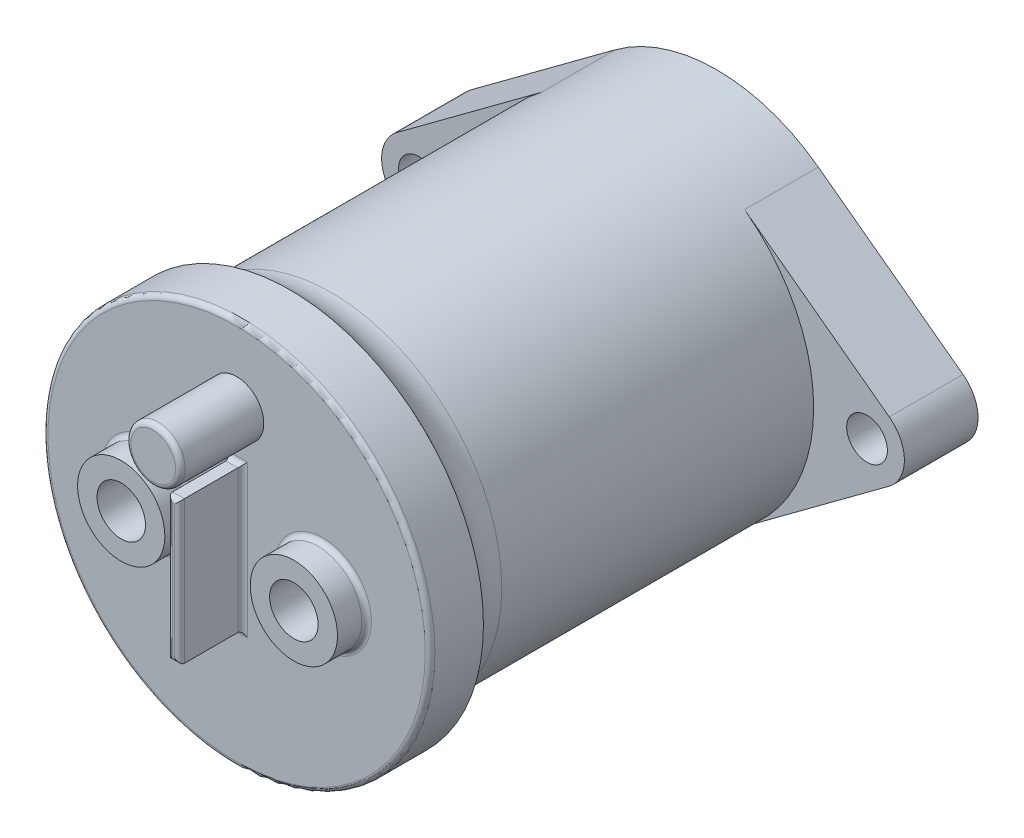
from build123d import *

# Parameters (mm, degrees)
SKETCH2_R           = 17.6
BOSS_EXTRUDE1_DEPTH = 52.5
SKETCH3_R           = 2.1
BOSS_EXTRUDE2_DEPTH = 7.6
SKETCH4_W           = 1.23
SKETCH4_H           = 14.7
BOSS_EXTRUDE3_DEPTH = 3.5
CUT_EXTRUDE1_START  = -3
SKETCH5_R           = 17.6
SKETCH5_R_2         = 4.5
SKETCH5_W           = 1.23
SKETCH5_H           = 14.7
SKETCH5_R_3         = 2.5
CUT_EXTRUDE1_DEPTH  = 3
SKETCH7_R           = 19.95
BOSS_EXTRUDE5_DEPTH = 5.5
FILLET3_R           = 5
FILLET4_R           = 0.5
CUT_EXTRUDE2_START  = -7
SKETCH8_R           = 2.5
CUT_EXTRUDE2_DEPTH  = 7
SKETCH10_R          = 2.8
BOSS_EXTRUDE6_DEPTH = 8.6
FILLET5_R           = 0.5


with BuildPart() as part:
    # Sketch2 → Boss-Extrude1 (new body)
    with BuildSketch(Plane.XY):
        Circle(SKETCH2_R)
    extrude(amount=BOSS_EXTRUDE1_DEPTH)

    # Sketch3 → Boss-Extrude2 (add)
    # profile 1 of 2: a face of its own
    with BuildSketch(Plane.XY):
        with BuildLine():
            Line((-10.476190476, 14.14246913), (-25.391666667, 3.093665122))
            ThreePointArc((-25.391666667, 3.093665122), (-26.95, 0), (-25.391666667, -3.093665122))
            Line((-25.391666667, -3.093665122), (-10.476190476, -14.14246913))
            ThreePointArc((-10.476190476, -14.14246913), (-17.6, 0), (-10.476190476, 14.14246913))
        make_face()
        with Locations(Location((-23.1, 0, 0), (0, 0, 180))):
            Circle(SKETCH3_R, mode=Mode.SUBTRACT)
    # profile 2 of 2: a face of its own
    with BuildSketch(Plane.XY):
        with BuildLine():
            Line((25.391666667, 3.093665122), (10.476190476, 14.14246913))
            ThreePointArc((10.476190476, 14.14246913), (17.6, 0), (10.476190476, -14.14246913))
            Line((10.476190476, -14.14246913), (25.391666667, -3.093665122))
            ThreePointArc((25.391666667, -3.093665122), (26.95, 0), (25.391666667, 3.093665122))
        make_face()
        with Locations(Location((23.1, 0, 0), (0, 0, 180))):
            Circle(SKETCH3_R, mode=Mode.SUBTRACT)
    extrude(amount=BOSS_EXTRUDE2_DEPTH)

    # Sketch4 → Boss-Extrude3 (add)
    with BuildSketch(Plane.XY.offset(52.5)):
        Rectangle(SKETCH4_W, SKETCH4_H)
    extrude(amount=BOSS_EXTRUDE3_DEPTH)

    # Sketch5 → Cut-Extrude1 (cut)
    # profile 1 of 3: a face of its own
    with BuildSketch(Plane.XY.offset(52.5).offset(CUT_EXTRUDE1_START)):
        with Locations(Location((0, 0, 0), (0, 0, 126.52960723))):
            Circle(SKETCH5_R)
        with Locations((-8.9, 0)):
            Circle(SKETCH5_R_2, mode=Mode.SUBTRACT)
        with Locations((8.9, 0)):
            Circle(SKETCH5_R_2, mode=Mode.SUBTRACT)
        Rectangle(SKETCH5_W, SKETCH5_H, mode=Mode.SUBTRACT)
    # profile 2 of 3: a face of its own
    with BuildSketch(Plane.XY.offset(52.5).offset(CUT_EXTRUDE1_START)):
        with Locations((-8.9, 0)):
            Circle(SKETCH5_R_3)
    # profile 3 of 3: a face of its own
    with BuildSketch(Plane.XY.offset(52.5).offset(CUT_EXTRUDE1_START)):
        with Locations((8.9, 0)):
            Circle(SKETCH5_R_3)
    extrude(amount=CUT_EXTRUDE1_DEPTH, mode=Mode.SUBTRACT)

    # Sketch7 → Boss-Extrude5 (add)
    with BuildSketch(Plane.XY.offset(49.5)):
        Circle(SKETCH7_R)
    extrude(amount=-BOSS_EXTRUDE5_DEPTH)

    # Fillet3
    # the kernel refuses this fillet: 5 mm, written as the material it adds along each edge
    with BuildSketch(Plane(origin=(0, 0, 44), x_dir=(1, 0, 0), z_dir=(0, 1, 0))) as fillet3_piece_1:
        with BuildLine():
            CenterArc((22.6, 4.239988208), FILLET3_R, 180, 57.994545172)
            Line((19.95, 0), (19.897, -0.084799764))
            ThreePointArc((19.897, -0.084799764), (18.775, -0.1), (17.6, -0.1))
            Line((17.6, -0.1), (17.5, 0))
            Line((17.5, 0), (17.5, 4.239988208))
            Line((17.5, 4.239988208), (17.6, 4.239988208))
        make_face()
    revolve(axis=Axis((0, 0, 44), (0, 0, -1)))

    # Fillet4
    fillet4_edges = [part.edges().sort_by_distance(p)[0] for p in [
        (0.615, 0, 56),
        (0, 7.35, 56),
        (0, -7.35, 56),
        (-0.615, 0, 56),
        (0, 7.35, 49.5),
        (-0.615, 0, 49.5),
        (0, -7.35, 49.5),
        (0.615, 0, 49.5),
        (-13.4, 0, 49.5),
        (4.4, 0, 49.5),
        (-19.95, 0, 49.5),
    ]]
    fillet(fillet4_edges, radius=FILLET4_R)

    # Sketch8 → Cut-Extrude2 (cut)
    with BuildSketch(Plane.XY.offset(52.5).offset(CUT_EXTRUDE2_START)):
        with Locations((8.9, 0)):
            Circle(SKETCH8_R)
        with Locations((-8.9, 0)):
            Circle(SKETCH8_R)
    extrude(amount=CUT_EXTRUDE2_DEPTH, mode=Mode.SUBTRACT)

    # Sketch10 → Boss-Extrude6 (add)
    with BuildSketch(Plane.XY.offset(49.5)):
        with Locations(Location((0, 12.15, 0), (0, 0, 180))):
            Circle(SKETCH10_R)
    extrude(amount=BOSS_EXTRUDE6_DEPTH)

    # Fillet5
    fillet5_edges = [part.edges().sort_by_distance(p)[0] for p in [
        (2.8, 12.15, 58.1),
    ]]
    fillet(fillet5_edges, radius=FILLET5_R)


solid = part.part
